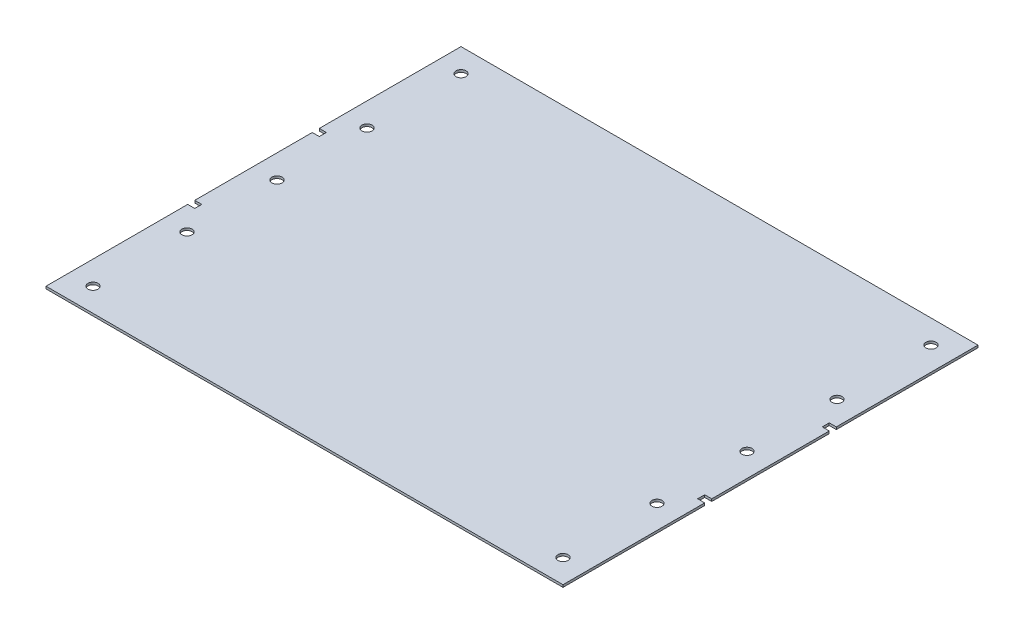
from build123d import *

# Parameters (mm, degrees)
SKETCH1_R           = 2.15
BOSS_EXTRUDE1_DEPTH = 1


with BuildPart() as part:
    # Sketch1 → Boss-Extrude1 (new body)
    with BuildSketch(Plane(origin=(0, 0, 0), x_dir=(1, 0, 0), z_dir=(0, 1, 0))):
        Polygon((-7, -28), (-10, -28), (-10, -88.3), (210, -88.3), (210, -28), (207, -28), (207, -25), (210, -25), (210, 25), (207, 25), (207, 28), (210, 28), (210, 88.3), (-10, 88.3), (-10, 28), (-7, 28), (-7, 25), (-10, 25), (-10, -25), (-7, -25), align=None)
        with Locations((0, -78.3)):
            Circle(SKETCH1_R, mode=Mode.SUBTRACT)
        with Locations((0, -38.3)):
            Circle(SKETCH1_R, mode=Mode.SUBTRACT)
        Circle(SKETCH1_R, mode=Mode.SUBTRACT)
        with Locations((200, -78.3)):
            Circle(SKETCH1_R, mode=Mode.SUBTRACT)
        with Locations((200, -38.3)):
            Circle(SKETCH1_R, mode=Mode.SUBTRACT)
        with Locations((200, 0)):
            Circle(SKETCH1_R, mode=Mode.SUBTRACT)
        with Locations((0, 38.3)):
            Circle(SKETCH1_R, mode=Mode.SUBTRACT)
        with Locations((0, 78.3)):
            Circle(SKETCH1_R, mode=Mode.SUBTRACT)
        with Locations((200, 38.3)):
            Circle(SKETCH1_R, mode=Mode.SUBTRACT)
        with Locations((200, 78.3)):
            Circle(SKETCH1_R, mode=Mode.SUBTRACT)
    extrude(amount=BOSS_EXTRUDE1_DEPTH)


solid = part.part
